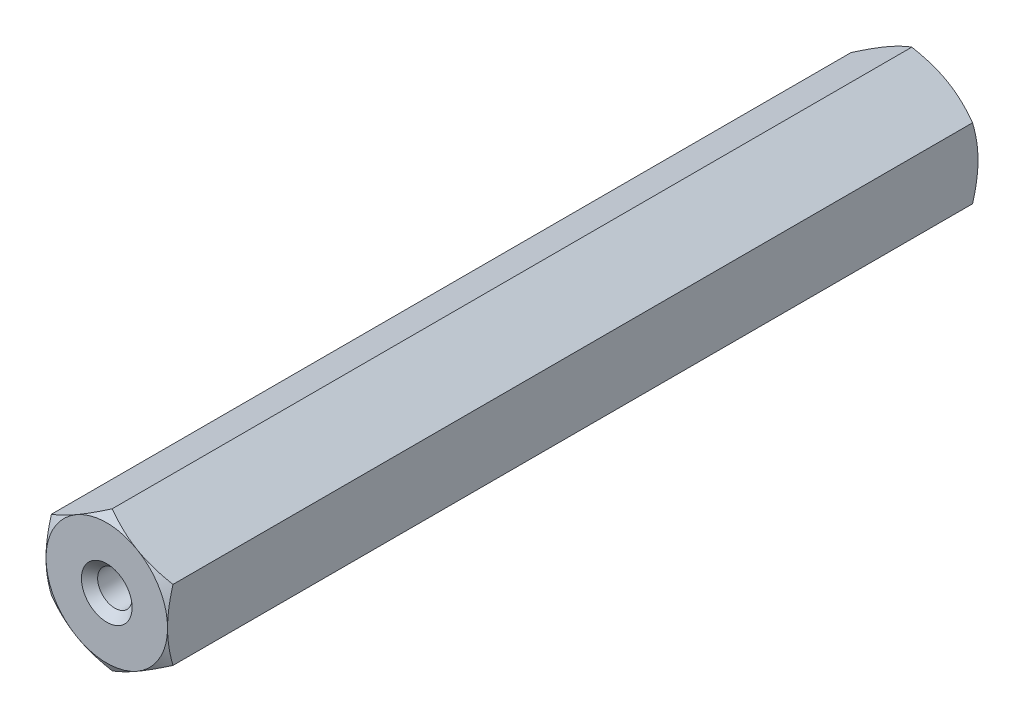
from build123d import *

# Parameters (mm, degrees)
EXTRUDE1_DEPTH                  = 31.75
EXTRUDE1_DEPTH_BACK             = 31.75
SKETCH1_R                       = 1.7526
SWEEP1_PITCH                    = 0.79375
EXTRUDE2_DEPTH                  = 65.704187324
SKETCH8_OUTSIDE_W               = 252.316
SKETCH8_OUTSIDE_H               = 253.788
SKETCH8_OUTSIDE_R               = 4.7625
EXTRUDE4_DEPTH                  = 65.704187324
EXTRUDE4_DRAFT                  = -60
MIRROR1_COPY_1_SKETCH_W         = 252.316
MIRROR1_COPY_1_SKETCH_H         = 253.788
MIRROR1_COPY_1_SKETCH_R         = 4.7625
MIRROR1_COPY_1_DEPTH            = 65.704187324
MIRROR1_COPY_1_DRAFT            = -60
SKETCH9_W                       = 44.45
SKETCH9_H                       = 1.8034
SKETCH13_R                      = 2.495343584
BOSS_EXTRUDE1_DEPTH             = 63.5
F_6_32_TAPPED_HOLE1_D           = 2.7051
F_6_32_TAPPED_HOLE1_DEPTH       = 10.9728
F_6_32_TAPPED_HOLE1_CSINK_D     = 3.9751
F_6_32_TAPPED_HOLE1_CSINK_ANGLE = 90
F_6_32_TAPPED_HOLE1_TIP         = 0.81269403
F_6_32_TAPPED_HOLE2_D           = 2.7051
F_6_32_TAPPED_HOLE2_DEPTH       = 10.9728
F_6_32_TAPPED_HOLE2_CSINK_D     = 3.9751
F_6_32_TAPPED_HOLE2_CSINK_ANGLE = 90
F_6_32_TAPPED_HOLE2_TIP         = 0.81269403


with BuildPart() as part:
    # Sketch1 → Extrude1 (new, two sides: drawn at the far end of the back side and taken through both)
    with BuildSketch(Plane.XY.offset(-EXTRUDE1_DEPTH_BACK)):
        Polygon((0, 5.499261314), (-4.7625, 2.749630657), (-4.7625, -2.749630657), (0, -5.499261314), (4.7625, -2.749630657), (4.7625, 2.749630657), align=None)
        Circle(SKETCH1_R, mode=Mode.SUBTRACT)
    extrude(amount=EXTRUDE1_DEPTH + EXTRUDE1_DEPTH_BACK)

    # Sweep1: arcs per turn and ends read off the stored shape
    # Sweep1: the profile of Sketch12 profile screwed along a right-hand helix through 81 turns, 6 arcs to a turn; built about Z, then put on its axis
    sweep1_z = Axis((0, 0, 0), (0, 0, 1))
    sweep1_corners = [(1.7529, 0, -0.694704455), (1.7529, 0, 0.000173205), (1.237044252, 0, -0.29765625), (1.237044252, 0, -0.396875)]
    with BuildLine(mode=Mode.PRIVATE) as sweep1_profile:
        Line(sweep1_corners[0], sweep1_corners[1])
        Line(sweep1_corners[1], sweep1_corners[2])
        Line(sweep1_corners[2], sweep1_corners[3])
        Line(sweep1_corners[3], sweep1_corners[0])
    sweep1_cap = Face(sweep1_profile.wire())
    sweep1_turn_angles = [0, 30, 60, 90, 120, 150, 180, 210, 240, 270, 300, 330, 360]
    sweep1_turn_weights = [1, 0.8660254037844387, 1, 0.8660254037844387, 1, 0.8660254037844387, 1, 0.8660254037844387, 1, 0.8660254037844387, 1, 0.8660254037844387, 1]
    sweep1_turn_rails = [Edge.make_bspline([Vector(p[0], p[1], 0).rotate(sweep1_z, sweep1_turn_angles[k]) / sweep1_turn_weights[k] + Vector(0, 0, p[2] + SWEEP1_PITCH * sweep1_turn_angles[k] / 360) for k in range(13)], [0, 0, 0, 1, 1, 2, 2, 3, 3, 4, 4, 5, 5, 6, 6, 6], 2, sweep1_turn_weights) for p in sweep1_corners]
    sweep1_turn_sides = [Face.make_surface_from_curves(sweep1_turn_rails[p[0]], sweep1_turn_rails[p[1]]) for p in [(0, 1), (1, 2), (2, 3), (3, 0)]]
    sweep1 = Plane(origin=(0, 0, -31.75), x_dir=(0, 1, 0), z_dir=(0, 0, 1)) * Solid(Shell([*[p.moved(Location((0, 0, SWEEP1_PITCH * i))) for i in range(81) for p in sweep1_turn_sides], sweep1_cap, sweep1_cap.rotate(sweep1_z, 29160).moved(Location((0, 0, SWEEP1_PITCH * 29160 / 360)))]))
    add(sweep1)

    # Sketch6 → Extrude2 (cut, through all)
    with BuildSketch(Plane(origin=(0, 0, -31.75), x_dir=(-1, 0, 0), z_dir=(0, 0, -1))):
        Polygon((0, 5.499261314), (-4.7625, 2.749630657), (-4.7625, -2.749630657), (0, -5.499261314), (4.7625, -2.749630657), (4.7625, 2.749630657), align=None)
    extrude2 = extrude(amount=EXTRUDE2_DEPTH, mode=Mode.SUBTRACT)

    # Extrude3 cone 1 section (through the dimple's axis) → Extrude3 (revolve, cut)
    with BuildSketch(Plane(origin=(0, 0, -31.75), x_dir=(0, 1, 0), z_dir=(1, 0, 0))):
        Polygon((0, 0), (1.8034, 0), (0, 1.933909732), align=None)
    extrude3 = revolve(axis=Axis((0, 0, -31.75), (0, 0, 1)), mode=Mode.SUBTRACT)


with BuildPart() as extrude4_tool:
    # Sketch8 outside → Extrude4 (with draft: the straight prism first)
    with BuildSketch(Plane(origin=(0, 0, -31.75), x_dir=(-1, 0, 0), z_dir=(0, 0, -1))):
        Rectangle(SKETCH8_OUTSIDE_W, SKETCH8_OUTSIDE_H)
        Circle(SKETCH8_OUTSIDE_R, mode=Mode.SUBTRACT)
    extrude(amount=-EXTRUDE4_DEPTH)
    # Extrude4: the draft: its side faces are tilted about the plane it starts from
    extrude4_sides = [extrude4_tool.faces().sort_by_distance(p)[0] for p in [
        (0, -126.894, 1.102093662),
        (-126.158, 0, 1.102093662),
        (0, 126.894, 1.102093662),
        (126.158, 0, 1.102093662),
        (4.7625, 0, 1.102093662),
    ]]
    draft(extrude4_sides, Plane(origin=(0, 0, -31.75), x_dir=(-1, 0, 0), z_dir=(0, 0, -1)), EXTRUDE4_DRAFT)


with BuildPart() as part_1:
    add(part.part)

    # Extrude4: cut by extrude4_tool
    add(extrude4_tool.part, mode=Mode.SUBTRACT)

    # Mirror1: Extrude2, Extrude3 across plane
    add(extrude2.mirror(Plane.XY), mode=Mode.SUBTRACT)
    add(extrude3.mirror(Plane.XY), mode=Mode.SUBTRACT)


with BuildPart() as mirror1_copy_1_tool:
    # Mirror1 copy 1 sketch → Mirror1 copy 1 (with draft: the straight prism first)
    with BuildSketch(Plane(origin=(0, 0, 31.75), x_dir=(-1, 0, 0), z_dir=(0, 0, 1))):
        Rectangle(MIRROR1_COPY_1_SKETCH_W, MIRROR1_COPY_1_SKETCH_H)
        Circle(MIRROR1_COPY_1_SKETCH_R, mode=Mode.SUBTRACT)
    extrude(amount=-MIRROR1_COPY_1_DEPTH)
    # Mirror1 copy 1: the draft: its side faces are tilted about the plane it starts from
    mirror1_copy_1_sides = [mirror1_copy_1_tool.faces().sort_by_distance(p)[0] for p in [
        (0, -126.894, -1.102093662),
        (-126.158, 0, -1.102093662),
        (0, 126.894, -1.102093662),
        (126.158, 0, -1.102093662),
        (4.7625, 0, -1.102093662),
    ]]
    draft(mirror1_copy_1_sides, Plane(origin=(0, 0, 31.75), x_dir=(-1, 0, 0), z_dir=(0, 0, 1)), MIRROR1_COPY_1_DRAFT)


with BuildPart() as part_2:
    add(part_1.part)

    # Mirror1 copy 1: cut by mirror1_copy_1_tool
    add(mirror1_copy_1_tool.part, mode=Mode.SUBTRACT)

    # Sketch9 → Revolve 2 (revolve)
    with BuildSketch(Plane(origin=(0, 0, 0), x_dir=(0, 0, -1), z_dir=(1, 0, 0)), mode=Mode.PRIVATE) as revolve_2_sk:
        with Locations((0, 0.9017)):
            Rectangle(SKETCH9_W, SKETCH9_H)
    revolve(revolve_2_sk.sketch.rotate(Axis((0, 0, 31.75), (0, 0, -1)), 90), axis=Axis((0, 0, 31.75), (0, 0, -1)))

    # Sketch13 → Boss-Extrude1 (add)
    with BuildSketch(Plane.XY.offset(31.75)):
        Circle(SKETCH13_R)
    extrude(amount=-BOSS_EXTRUDE1_DEPTH)

    # #6-32 Tapped Hole1
    with Locations(Plane.XY.offset(31.75)):
        with Locations((0, 0)):
            CounterSinkHole(F_6_32_TAPPED_HOLE1_D / 2, F_6_32_TAPPED_HOLE1_CSINK_D / 2, depth=F_6_32_TAPPED_HOLE1_DEPTH, counter_sink_angle=F_6_32_TAPPED_HOLE1_CSINK_ANGLE)
            with Locations((0, 0, -(F_6_32_TAPPED_HOLE1_DEPTH + F_6_32_TAPPED_HOLE1_TIP / 2))):  # 118° drill point
                Cone(0, F_6_32_TAPPED_HOLE1_D / 2, F_6_32_TAPPED_HOLE1_TIP, mode=Mode.SUBTRACT)

    # #6-32 Tapped Hole2
    with Locations(Plane(origin=(0, 0, -31.75), x_dir=(-1, 0, 0), z_dir=(0, 0, -1))):
        with Locations((0, 0)):
            CounterSinkHole(F_6_32_TAPPED_HOLE2_D / 2, F_6_32_TAPPED_HOLE2_CSINK_D / 2, depth=F_6_32_TAPPED_HOLE2_DEPTH, counter_sink_angle=F_6_32_TAPPED_HOLE2_CSINK_ANGLE)
            with Locations((0, 0, -(F_6_32_TAPPED_HOLE2_DEPTH + F_6_32_TAPPED_HOLE2_TIP / 2))):  # 118° drill point
                Cone(0, F_6_32_TAPPED_HOLE2_D / 2, F_6_32_TAPPED_HOLE2_TIP, mode=Mode.SUBTRACT)


solid = part_2.part
